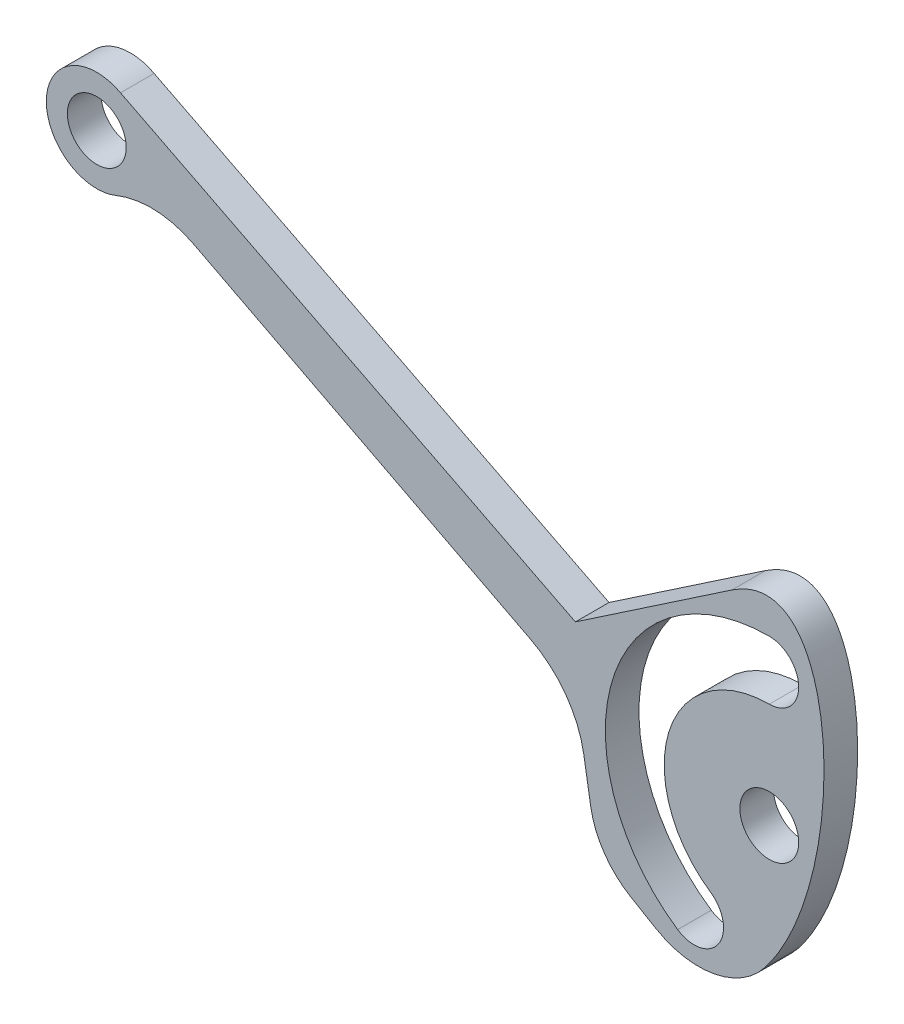
from build123d import *

# Parameters (mm, degrees)
SKETCH1_R           = 1.75
BOSS_EXTRUDE1_DEPTH = 2
SCALE1_DEPTH        = 2
SCALE1_START        = -0.999756802
SCALE1_2_OUTLINE_R  = 3.5
SCALE1_2_DEPTH      = 4
FILLET1_R           = 12
FILLET3_R           = 11
FILLET5_R           = 10


# Read off the part's stored shape, not the designer's step: Scale1
with BuildPart() as part:
    # Sketch1 → Boss-Extrude1 (new body)
    with BuildSketch(Plane.XY):
        with BuildLine():
            Line((37.774530777, -2.80976251), (28.469572838, -9.10701388))
            Line((28.469572838, -9.10701388), (1.412522165, 4.616654706))
            ThreePointArc((1.412522165, 4.616654706), (-2.864052097, 1.077136302), (2.666294703, 0.594909982))
            Line((2.666294703, 0.594909982), (28.469572838, -12.71263256))
            Line((28.469572838, -12.71263256), (29.76626198, -20.464203372))
            Line((29.76626198, -20.464203372), (35.819506235, -24.004020415))
            add(Edge.make_bspline(
                [(37.774530777, -2.80976251), (45.596954448, 2.484164502), (45.142122532, -21.709783765), (35.819506235, -24.004020415)],
                knots=[0, 0, 0, 0, 1, 1, 1, 1], degree=3))
        make_face()
        with Locations((0, 1.97)):
            Circle(SKETCH1_R, mode=Mode.SUBTRACT)
        with Locations((40, -13.83)):
            Circle(SKETCH1_R, mode=Mode.SUBTRACT)
        with BuildLine():
            ThreePointArc((40, -7.58), (41.75, -5.83), (40, -4.08))
            ThreePointArc((40, -4.08), (30.675422402, -10.981359514), (34.551308869, -21.91543536))
            ThreePointArc((34.551308869, -21.91543536), (36.98051106, -21.442173575), (36.507249275, -19.012971384))
            ThreePointArc((36.507249275, -19.012971384), (34.022706668, -12.003948406), (40, -7.58))
        make_face(mode=Mode.SUBTRACT)
    extrude(amount=BOSS_EXTRUDE1_DEPTH)

    # Scale1 outline → Scale1 (cut)
    with BuildSketch(Plane.XY):
        with BuildLine():
            Line((37.166911335, -4.500685523), (40.588309586, -2.185209734))
            add(Edge.make_bspline(
                [(37.774530777, -2.80976251), (38.877601708, -2.063244904), (39.816079935, -1.903091828), (40.588309586, -2.185209734)],
                knots=[0, 0, 0, 0, 0.141013959, 0.141013959, 0.141013959, 0.141013959], degree=3))
            Line((37.774530777, -2.80976251), (29.220510655, -8.598806941))
            Line((29.220510655, -8.598806941), (30.301368209, -9.147031174))
            Line((30.301368209, -9.147031174), (32.392388987, -7.731905652))
            ThreePointArc((32.392388987, -7.731905652), (34.535363844, -5.75533272), (37.166911335, -4.500685523))
        make_face()
        with BuildLine():
            add(Edge.make_bspline(
                [(41.674674498, -2.9836722), (42.973808679, -4.53190383), (43.478218434, -7.820529427), (43.170733001, -11.35535593)],
                knots=[0.215661709, 0.215661709, 0.215661709, 0.215661709, 0.523164808, 0.523164808, 0.523164808, 0.523164808], degree=3))
            ThreePointArc((41.674674498, -2.9836722), (40.978551915, -3.529979081), (40.307930669, -4.107304814))
            ThreePointArc((40.307930669, -4.107304814), (41.743160431, -5.984569442), (40, -7.58))
            ThreePointArc((40, -7.58), (38.251209419, -7.829647385), (36.642124757, -8.558645918))
            ThreePointArc((36.642124757, -8.558645918), (34.994244779, -12.045683869), (34.064898938, -15.788845421))
            ThreePointArc((34.064898938, -15.788845421), (35.018048135, -17.603944304), (36.507249275, -19.012971384))
            ThreePointArc((36.507249275, -19.012971384), (36.98051106, -21.442173575), (34.551308869, -21.91543536))
            ThreePointArc((34.551308869, -21.91543536), (34.320026917, -21.754670705), (34.093485318, -21.587292331))
            ThreePointArc((34.093485318, -21.587292331), (34.234790142, -22.386594073), (34.409236622, -23.179322749))
            Line((34.409236622, -23.179322749), (35.819506235, -24.004020415))
            add(Edge.make_bspline(
                [(40.894606009, -19.492190926), (39.678153764, -21.750341152), (37.988934356, -23.470137935), (35.819506235, -24.004020415)],
                knots=[0.767294067, 0.767294067, 0.767294067, 0.767294067, 1, 1, 1, 1], degree=3))
            ThreePointArc((40.894606009, -19.492190926), (40.948505364, -17.126843118), (41.447135601, -14.814021622))
            ThreePointArc((41.447135601, -14.814021622), (38.35159174, -13.242420041), (41.74328031, -13.983211488))
            ThreePointArc((41.74328031, -13.983211488), (42.378136793, -12.626441553), (43.170733001, -11.35535593))
        make_face()
        Polygon((29.76626198, -20.464203372), (31.120707631, -21.256256294), (30.301368209, -16.358268534), (28.964044419, -15.668569608), align=None)
        with BuildLine():
            ThreePointArc((-2.699495917, 0.661290027), (-1.375090017, -0.696294703), (0.498906862, -0.988224458))
            Line((0.498906862, -0.988224458), (-2.699495917, 0.661290027))
        make_face()
    extrude(amount=SCALE1_DEPTH, mode=Mode.SUBTRACT)

    # Scale1 2 outline → Scale1 2 (add)
    with BuildSketch(Plane.XY.offset(SCALE1_START)):
        with BuildLine():
            add(Edge.make_bspline(
                [(48.911284088, 3.447471566), (64.556131429, 14.03532559), (63.646467598, -34.352570942), (45.001235003, -38.941044242)],
                knots=[0, 0, 0, 0, 1, 1, 1, 1], degree=3))
            Line((48.911284088, 3.447471566), (30.301368209, -9.147031174))
            Line((30.301368209, -9.147031174), (-23.812733137, 18.300305999))
            ThreePointArc((-23.812733137, 18.300305999), (-32.365881661, 11.221269191), (-21.305188061, 10.256816551))
            Line((-21.305188061, 10.256816551), (30.301368209, -16.358268534))
            Line((30.301368209, -16.358268534), (32.894746493, -31.861410158))
            Line((32.894746493, -31.861410158), (45.001235003, -38.941044242))
        make_face()
        with BuildLine():
            ThreePointArc((42.464840271, -34.763874133), (34.713067338, -12.89572244), (53.362222534, 0.906996587))
            ThreePointArc((53.362222534, 0.906996587), (56.862222534, -2.593003413), (53.362222534, -6.093003413))
            ThreePointArc((53.362222534, -6.093003413), (41.40763587, -14.940900225), (46.376721083, -28.958946182))
            ThreePointArc((46.376721083, -28.958946182), (47.323244653, -33.817350564), (42.464840271, -34.763874133))
        make_face(mode=Mode.SUBTRACT)
        with Locations((53.362222534, -18.593003413)):
            Circle(SCALE1_2_OUTLINE_R, mode=Mode.SUBTRACT)
        with Locations((-26.637777466, 13.006996587)):
            Circle(SCALE1_2_OUTLINE_R, mode=Mode.SUBTRACT)
    extrude(amount=SCALE1_2_DEPTH)

    # Fillet1
    fillet1_edges = [part.edges().sort_by_distance(p)[0] for p in [
        (30.301368209, -16.358268534, 1),
    ]]
    fillet(fillet1_edges, radius=FILLET1_R)

    # Fillet3
    fillet3_edges = [part.edges().sort_by_distance(p)[0] for p in [
        (-21.305188061, 10.256816551, 1.000243198),
    ]]
    fillet(fillet3_edges, radius=FILLET3_R)

    # Fillet5
    fillet5_edges = [part.edges().sort_by_distance(p)[0] for p in [
        (45.001235003, -38.941044242, 1.000243198),
        (32.894746493, -31.861410158, 1.000243198),
    ]]
    fillet(fillet5_edges, radius=FILLET5_R)


solid = part.part
